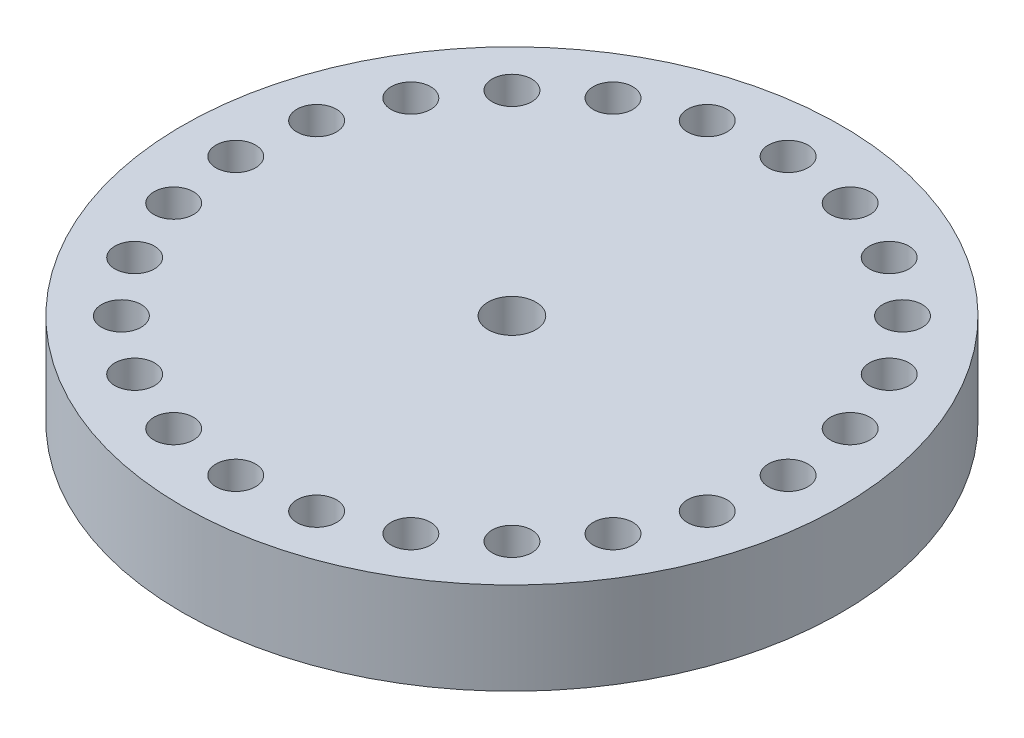
from build123d import *

# Parameters (mm, degrees)
SKETCH1_R                                        = 45.466
BOSS_EXTRUDE1_DEPTH                              = 25.4
CSK_FOR_1_4_FLAT_HEAD_MACHINE_SCREW1_D           = 6.5278
CSK_FOR_1_4_FLAT_HEAD_MACHINE_SCREW1_DEPTH       = 25.4
CSK_FOR_1_4_FLAT_HEAD_MACHINE_SCREW1_CSINK_D     = 12.8778
CSK_FOR_1_4_FLAT_HEAD_MACHINE_SCREW1_CSINK_ANGLE = 82
CSK_FOR_1_4_FLAT_HEAD_MACHINE_SCREW1_TIP         = 1.961148974
SKETCH8_R                                        = 46.955588052
CUT_EXTRUDE2_DEPTH                               = 12.7
SKETCH4_R                                        = 1.9812
CUT_EXTRUDE3_DEPTH                               = 66.540859866
SKETCH9_R                                        = 2.7305
CUT_EXTRUDE4_DEPTH                               = 5.08
SKETCH11_R                                       = 3.302
CUT_EXTRUDE5_DEPTH                               = 66.540859866
CIRPATTERN2_COUNT                                = 24
CIRPATTERN3_COUNT                                = 24


with BuildPart() as part:
    # Sketch1 → Boss-Extrude1 (new body)
    with BuildSketch(Plane(origin=(0, 0, 0), x_dir=(1, 0, 0), z_dir=(0, 1, 0))):
        Circle(SKETCH1_R)
    extrude(amount=BOSS_EXTRUDE1_DEPTH)

    # CSK for 1/4 Flat Head Machine Screw1
    with Locations(Plane(origin=(0, 25.4, 0), x_dir=(1, 0, 0), z_dir=(0, 1, 0))):
        with Locations((0, 0)):
            CounterSinkHole(CSK_FOR_1_4_FLAT_HEAD_MACHINE_SCREW1_D / 2, CSK_FOR_1_4_FLAT_HEAD_MACHINE_SCREW1_CSINK_D / 2, depth=CSK_FOR_1_4_FLAT_HEAD_MACHINE_SCREW1_DEPTH, counter_sink_angle=CSK_FOR_1_4_FLAT_HEAD_MACHINE_SCREW1_CSINK_ANGLE)
            with Locations((0, 0, -(CSK_FOR_1_4_FLAT_HEAD_MACHINE_SCREW1_DEPTH + CSK_FOR_1_4_FLAT_HEAD_MACHINE_SCREW1_TIP / 2))):  # 118° drill point
                Cone(0, CSK_FOR_1_4_FLAT_HEAD_MACHINE_SCREW1_D / 2, CSK_FOR_1_4_FLAT_HEAD_MACHINE_SCREW1_TIP, mode=Mode.SUBTRACT)

    # Sketch8 → Cut-Extrude2 (cut)
    with BuildSketch(Plane(origin=(0, 25.4, 0), x_dir=(1, 0, 0), z_dir=(0, 1, 0))):
        Circle(SKETCH8_R)
    extrude(amount=-CUT_EXTRUDE2_DEPTH, mode=Mode.SUBTRACT)

    # Sketch4 → Cut-Extrude3 (cut, through all)
    with BuildSketch(Plane.XZ):
        with Locations((0, 38.1)):
            Circle(SKETCH4_R)
    cut_extrude3 = extrude(amount=-CUT_EXTRUDE3_DEPTH, mode=Mode.SUBTRACT)

    # Sketch9 → Cut-Extrude4 (cut)
    with BuildSketch(Plane(origin=(0, 12.7, 0), x_dir=(1, 0, 0), z_dir=(0, 1, 0))):
        with Locations((0, -38.1)):
            Circle(SKETCH9_R)
    cut_extrude4 = extrude(amount=-CUT_EXTRUDE4_DEPTH, mode=Mode.SUBTRACT)

    # Sketch11 → Cut-Extrude5 (cut, through all)
    with BuildSketch(Plane(origin=(0, 12.7, 0), x_dir=(1, 0, 0), z_dir=(0, 1, 0))):
        Circle(SKETCH11_R)
    extrude(amount=-CUT_EXTRUDE5_DEPTH, mode=Mode.SUBTRACT)

    # CirPattern2: Cut-Extrude3 ×24 about axis
    cirpattern2_axis = Axis((0, 12.7, 0), (0, 1, 0))
    for i in range(1, CIRPATTERN2_COUNT):
        add(cut_extrude3.rotate(cirpattern2_axis, i * 360 / CIRPATTERN2_COUNT), mode=Mode.SUBTRACT)

    # CirPattern3: Cut-Extrude4 ×24 about axis
    cirpattern3_axis = Axis((0, 12.7, 0), (0, 1, 0))
    for i in range(1, CIRPATTERN3_COUNT):
        add(cut_extrude4.rotate(cirpattern3_axis, i * 360 / CIRPATTERN3_COUNT), mode=Mode.SUBTRACT)

    # Sketch13 → Revolve1 (revolve)
    with BuildSketch(Plane.YZ):
        with BuildLine():
            Line((0, 0), (-14.179303561, 0))
            ThreePointArc((-14.179303561, 0), (-14.007568062, 1.162621435), (-13.472719499, 2.209100627))
            Line((-13.472719499, 2.209100627), (0, 19.05))
            Line((0, 19.05), (0, 0))
        make_face()
    revolve(axis=Axis((0, 0, 0), (0, -1, 0)))


solid = part.part
